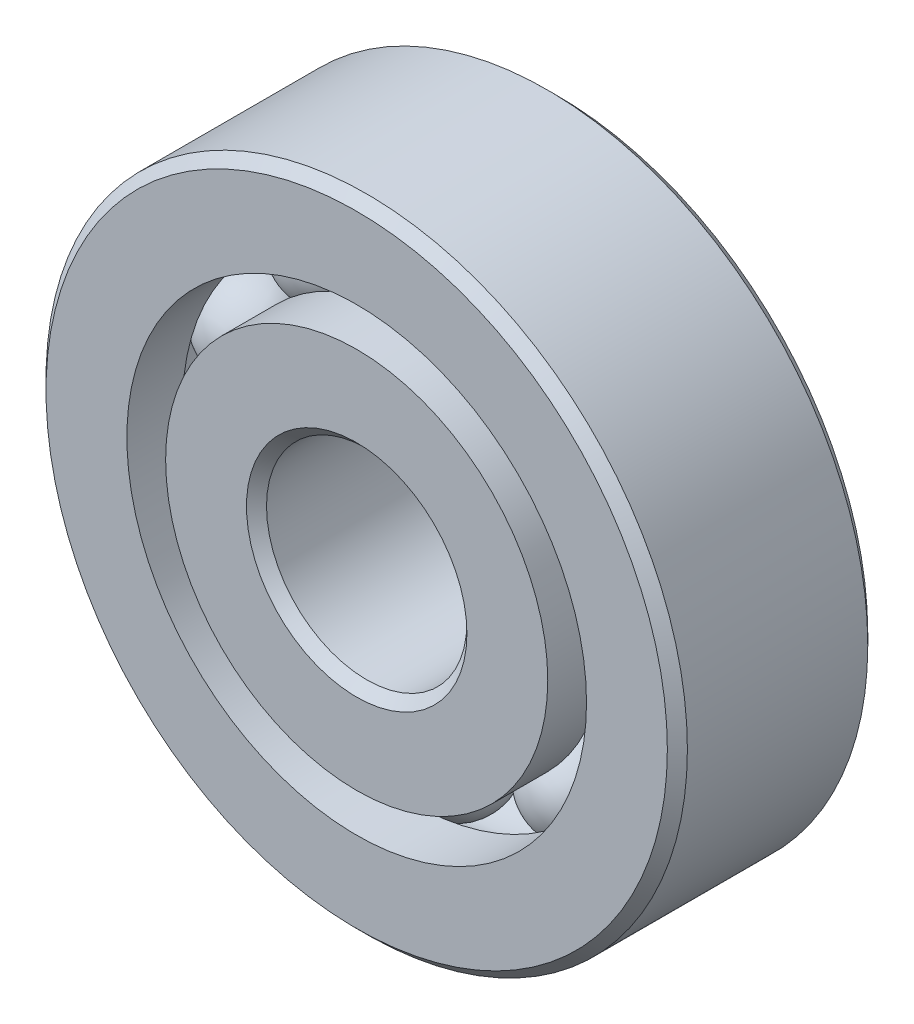
from build123d import *

# Parameters (mm, degrees)
CIRPATTERN1_COUNT = 10


with BuildPart() as part:
    # Sketch1 → Revolve1 (revolve)
    with BuildSketch(Plane(origin=(0, 0, 0), x_dir=(0, 0, -1), z_dir=(1, 0, 0))):
        with BuildLine():
            Line((2.25, 8), (-2.25, 8))
            Line((-2.25, 8), (-2.5, 7.75))
            Line((-2.5, 7.75), (-2.5, 5.733516484))
            Line((-2.5, 5.733516484), (-1.111111111, 5.733516484))
            ThreePointArc((-1.111111111, 5.733516484), (0, 6.461757439), (1.111111111, 5.733516484))
            Line((1.111111111, 5.733516484), (2.5, 5.733516484))
            Line((2.5, 5.733516484), (2.5, 7.75))
            Line((2.5, 7.75), (2.25, 8))
        make_face()
    revolve(axis=Axis((0, 0, 2.5), (0, 0, -1)))


with BuildPart() as body_2:
    # Sketch3 → Revolve3 (revolve)
    with BuildSketch(Plane(origin=(0, 0, 0), x_dir=(0, 0, -1), z_dir=(1, 0, 0))):
        with BuildLine():
            Line((-2.5, 4.766483516), (-1.111111111, 4.766483516))
            ThreePointArc((-1.111111111, 4.766483516), (0, 4.038242561), (1.111111111, 4.766483516))
            Line((1.111111111, 4.766483516), (2.5, 4.766483516))
            Line((2.5, 4.766483516), (2.5, 2.75))
            Line((2.5, 2.75), (2.25, 2.5))
            Line((2.25, 2.5), (-2.25, 2.5))
            Line((-2.25, 2.5), (-2.5, 2.75))
            Line((-2.5, 2.75), (-2.5, 4.766483516))
        make_face()
    revolve(axis=Axis((0, 0, 2.5), (0, 0, -1)))


with BuildPart() as body_3:
    # Sketch4 → Revolve4 (revolve)
    with BuildSketch(Plane(origin=(0, 0, 0), x_dir=(0, 0, -1), z_dir=(1, 0, 0))):
        with BuildLine():
            Line((-1.211757439, 5.25), (1.211757439, 5.25))
            ThreePointArc((1.211757439, 5.25), (0, 6.461757439), (-1.211757439, 5.25))
        make_face()
    revolve(axis=Axis((0, 5.25, 1.211757439), (0, 0, -1)))


with BuildPart() as cirpattern1_1:
    # CirPattern1: pattern copy
    add(body_3.part.rotate(Axis((0, 0, -2.5), (0, 0, 1)), 1 * 360 / CIRPATTERN1_COUNT))


with BuildPart() as cirpattern1_2:
    # CirPattern1: pattern copy
    add(body_3.part.rotate(Axis((0, 0, -2.5), (0, 0, 1)), 2 * 360 / CIRPATTERN1_COUNT))


with BuildPart() as cirpattern1_3:
    # CirPattern1: pattern copy
    add(body_3.part.rotate(Axis((0, 0, -2.5), (0, 0, 1)), 3 * 360 / CIRPATTERN1_COUNT))


with BuildPart() as cirpattern1_4:
    # CirPattern1: pattern copy
    add(body_3.part.rotate(Axis((0, 0, -2.5), (0, 0, 1)), 4 * 360 / CIRPATTERN1_COUNT))


with BuildPart() as cirpattern1_5:
    # CirPattern1: pattern copy
    add(body_3.part.rotate(Axis((0, 0, -2.5), (0, 0, 1)), 5 * 360 / CIRPATTERN1_COUNT))


with BuildPart() as cirpattern1_6:
    # CirPattern1: pattern copy
    add(body_3.part.rotate(Axis((0, 0, -2.5), (0, 0, 1)), 6 * 360 / CIRPATTERN1_COUNT))


with BuildPart() as cirpattern1_7:
    # CirPattern1: pattern copy
    add(body_3.part.rotate(Axis((0, 0, -2.5), (0, 0, 1)), 7 * 360 / CIRPATTERN1_COUNT))


with BuildPart() as cirpattern1_8:
    # CirPattern1: pattern copy
    add(body_3.part.rotate(Axis((0, 0, -2.5), (0, 0, 1)), 8 * 360 / CIRPATTERN1_COUNT))


with BuildPart() as cirpattern1_9:
    # CirPattern1: pattern copy
    add(body_3.part.rotate(Axis((0, 0, -2.5), (0, 0, 1)), 9 * 360 / CIRPATTERN1_COUNT))


solid = Compound([part.part, body_2.part, body_3.part, cirpattern1_1.part, cirpattern1_2.part, cirpattern1_3.part, cirpattern1_4.part, cirpattern1_5.part, cirpattern1_6.part, cirpattern1_7.part, cirpattern1_8.part, cirpattern1_9.part])
